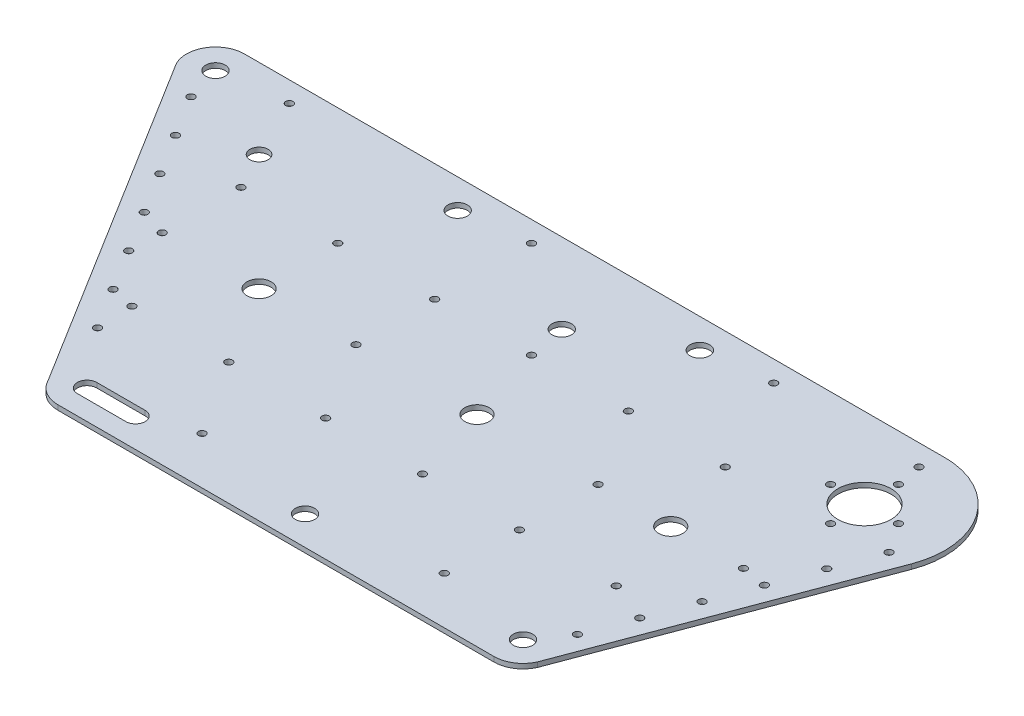
from build123d import *

# Parameters (mm, degrees)
SKETCH2_R           = 1.5
SKETCH2_R_2         = 4
SKETCH2_R_3         = 5
BOSS_EXTRUDE1_DEPTH = 2


with BuildPart() as part:
    # Sketch2 → Boss-Extrude1 (new body)
    with BuildSketch(Plane(origin=(0, 0, 0), x_dir=(1, 0, 0), z_dir=(0, 1, 0))):
        with BuildLine():
            Line((182.962816245, 145.197156615), (-106.00499968, 144.943614194))
            add(Edge.make_bspline(
                [(-106.00499968, 144.943614194), (-127.678824036, 144.924558741), (-116.08526313, 126.611232779)],
                knots=[0.000879148, 0.000879148, 0.000879148, 2.135198153, 2.135198153, 2.135198153], degree=2, weights=[1, 0.482613975, 1]))
            Line((-116.08526313, 126.611232779), (-29.699861268, -12.428586042))
            add(Edge.make_bspline(
                [(-29.699861268, -12.428586042), (-26.366669696, -18.999958873), (-18.998606102, -18.99996049)],
                knots=[5.181825727, 5.181825727, 5.181825727, 6.283185508, 6.283185508, 6.283185508], degree=2, weights=[1, 0.852168955, 1]))
            Line((-18.998606102, -18.99996049), (160.992350179, -19))
            add(Edge.make_bspline(
                [(160.992350179, -19), (168.692373591, -19.000128232), (171.90071668, -12.000000001)],
                knots=[3.141576001, 3.141576001, 3.141576001, 4.282613549, 4.282613549, 4.282613549], degree=2, weights=[1, 0.841620915, 1]))
            Line((171.90071668, -12.000000001), (214.069631291, 100.332253712))
            add(Edge.make_bspline(
                [(214.069631291, 100.332253712), (230.927799732, 145.239327045), (182.962816245, 145.197156615)],
                knots=[4.353250182, 4.353250182, 4.353250182, 6.284064455, 6.284064455, 6.284064455], degree=2, weights=[1, 0.569082143, 1]))
        make_face()
        with Locations((-38.361920415, 16.671266638)):
            Circle(SKETCH2_R, mode=Mode.SUBTRACT)
        with BuildLine():
            add(Edge.make_bspline(
                [(-18.998603467, -3), (-22.998556935, -3), (-22.998556935, -7), (-22.998556935, -11), (-18.998603467, -11)],
                knots=[3.141592654, 3.141592654, 3.141592654, 4.71238898, 4.71238898, 6.283185307, 6.283185307, 6.283185307], degree=2, weights=[1, 0.707106781, 1, 0.707106781, 1]))
            Line((-18.998603467, -3), (1.00035, -3))
            add(Edge.make_bspline(
                [(1.00035, -11), (5.00035, -11), (5.00035, -7), (5.00035, -3), (1.00035, -3)],
                knots=[3.141592654, 3.141592654, 3.141592654, 4.71238898, 4.71238898, 6.283185307, 6.283185307, 6.283185307], degree=2, weights=[1, 0.707106781, 1, 0.707106781, 1]))
            Line((1.00035, -11), (-18.998603467, -11))
        make_face(mode=Mode.SUBTRACT)
        with BuildLine():
            add(Edge.make_bspline(
                [(20.99895, 2), (18.401003692, 2), (19.699976846, -0.25), (20.99895, -2.5), (22.297923154, -0.25), (23.596896308, 2), (20.99895, 2)],
                knots=[0, 0, 0, 2.094395102, 2.094395102, 4.188790205, 4.188790205, 6.283185307, 6.283185307, 6.283185307], degree=2, weights=[1, 0.5, 1, 0.5, 1, 0.5, 1]))
        make_face(mode=Mode.SUBTRACT)
        with BuildLine():
            add(Edge.make_bspline(
                [(-38.99805, 32.999994311), (-41.595996308, 32.999994311), (-40.297023154, 30.749994311), (-38.99805, 28.499994311), (-37.699076846, 30.749994311), (-36.400103692, 32.999994311), (-38.99805, 32.999994311)],
                knots=[0, 0, 0, 2.094395102, 2.094395102, 4.188790205, 4.188790205, 6.283185307, 6.283185307, 6.283185307], degree=2, weights=[1, 0.5, 1, 0.5, 1, 0.5, 1]))
        make_face(mode=Mode.SUBTRACT)
        with Locations((-48.916261932, 33.658786529)):
            Circle(SKETCH2_R, mode=Mode.SUBTRACT)
        with Locations((-59.470762984, 50.646563195)):
            Circle(SKETCH2_R, mode=Mode.SUBTRACT)
        with BuildLine():
            add(Edge.make_bspline(
                [(0.99995, 32.999992415), (-1.597996308, 32.999992415), (-0.299023154, 30.749992415), (0.99995, 28.499992415), (2.298923154, 30.749992415), (3.597896308, 32.999992415), (0.99995, 32.999992415)],
                knots=[0, 0, 0, 2.094395102, 2.094395102, 4.188790205, 4.188790205, 6.283185307, 6.283185307, 6.283185307], degree=2, weights=[1, 0.5, 1, 0.5, 1, 0.5, 1]))
        make_face(mode=Mode.SUBTRACT)
        with BuildLine():
            add(Edge.make_bspline(
                [(40.99795, 32.999988622), (38.400003692, 32.999988622), (39.698976846, 30.749988622), (40.99795, 28.499988622), (42.296923154, 30.749988622), (43.595896308, 32.999988622), (40.99795, 32.999988622)],
                knots=[0, 0, 0, 2.094395102, 2.094395102, 4.188790205, 4.188790205, 6.283185307, 6.283185307, 6.283185307], degree=2, weights=[1, 0.5, 1, 0.5, 1, 0.5, 1]))
        make_face(mode=Mode.SUBTRACT)
        with Locations((70.99665, -7)):
            Circle(SKETCH2_R_2, mode=Mode.SUBTRACT)
        with BuildLine():
            add(Edge.make_bspline(
                [(120.99395, 2), (118.396003692, 2), (119.694976846, -0.25), (120.99395, -2.5), (122.292923154, -0.25), (123.591896308, 2), (120.99395, 2)],
                knots=[0, 0, 0, 2.094395102, 2.094395102, 4.188790205, 4.188790205, 6.283185307, 6.283185307, 6.283185307], degree=2, weights=[1, 0.5, 1, 0.5, 1, 0.5, 1]))
        make_face(mode=Mode.SUBTRACT)
        with BuildLine():
            add(Edge.make_bspline(
                [(160.99255, -3), (154.06434677, -3), (157.528448385, -9), (160.99255, -15), (164.456651615, -9), (167.92075323, -3), (160.99255, -3)],
                knots=[0, 0, 0, 2.094395102, 2.094395102, 4.188790205, 4.188790205, 6.283185307, 6.283185307, 6.283185307], degree=2, weights=[1, 0.5, 1, 0.5, 1, 0.5, 1]))
        make_face(mode=Mode.SUBTRACT)
        with Locations((170.332531489, 6.118627774)):
            Circle(SKETCH2_R, mode=Mode.SUBTRACT)
        with BuildLine():
            add(Edge.make_bspline(
                [(80.99595, 32.999985778), (78.398003692, 32.999985778), (79.696976846, 30.749985778), (80.99595, 28.499985778), (82.294923154, 30.749985778), (83.593896308, 32.999985778), (80.99595, 32.999985778)],
                knots=[0, 0, 0, 2.094395102, 2.094395102, 4.188790205, 4.188790205, 6.283185307, 6.283185307, 6.283185307], degree=2, weights=[1, 0.5, 1, 0.5, 1, 0.5, 1]))
        make_face(mode=Mode.SUBTRACT)
        with BuildLine():
            add(Edge.make_bspline(
                [(120.99395, 32.999981037), (118.396003692, 32.999981037), (119.694976846, 30.749981037), (120.99395, 28.499981037), (122.292923154, 30.749981037), (123.591896308, 32.999981037), (120.99395, 32.999981037)],
                knots=[0, 0, 0, 2.094395102, 2.094395102, 4.188790205, 4.188790205, 6.283185307, 6.283185307, 6.283185307], degree=2, weights=[1, 0.5, 1, 0.5, 1, 0.5, 1]))
        make_face(mode=Mode.SUBTRACT)
        with BuildLine():
            add(Edge.make_bspline(
                [(160.99195, 32.999978192), (158.394003692, 32.999978192), (159.692976846, 30.749978192), (160.99195, 28.499978192), (162.290923154, 30.749978192), (163.589896308, 32.999978192), (160.99195, 32.999978192)],
                knots=[0, 0, 0, 2.094395102, 2.094395102, 4.188790205, 4.188790205, 6.283185307, 6.283185307, 6.283185307], degree=2, weights=[1, 0.5, 1, 0.5, 1, 0.5, 1]))
        make_face(mode=Mode.SUBTRACT)
        with Locations((177.330672341, 24.854456596)):
            Circle(SKETCH2_R, mode=Mode.SUBTRACT)
        with Locations((184.328557385, 43.589600555)):
            Circle(SKETCH2_R, mode=Mode.SUBTRACT)
        with Locations((191.32646769, 62.324812144)):
            Circle(SKETCH2_R, mode=Mode.SUBTRACT)
        with Locations((-70.02547384, 67.634677545)):
            Circle(SKETCH2_R, mode=Mode.SUBTRACT)
        with BuildLine():
            add(Edge.make_bspline(
                [(-58.99705, 65.5), (-61.594996308, 65.5), (-60.296023154, 63.25), (-58.99705, 61), (-57.698076846, 63.25), (-56.399103692, 65.5), (-58.99705, 65.5)],
                knots=[0, 0, 0, 2.094395102, 2.094395102, 4.188790205, 4.188790205, 6.283185307, 6.283185307, 6.283185307], degree=2, weights=[1, 0.5, 1, 0.5, 1, 0.5, 1]))
        make_face(mode=Mode.SUBTRACT)
        with BuildLine():
            add(Edge.make_bspline(
                [(-91.134705429, 103.110600241), (-93.732651737, 103.110600241), (-92.433678583, 100.860600241), (-91.134705429, 98.610600241), (-89.835732276, 100.860600241), (-88.536759122, 103.110600241), (-91.134705429, 103.110600241)],
                knots=[0, 0, 0, 2.094395102, 2.094395102, 4.188790205, 4.188790205, 6.283185307, 6.283185307, 6.283185307], degree=2, weights=[1, 0.5, 1, 0.5, 1, 0.5, 1]))
        make_face(mode=Mode.SUBTRACT)
        with Locations((-80.580283096, 84.622950275)):
            Circle(SKETCH2_R, mode=Mode.SUBTRACT)
        with BuildLine():
            add(Edge.make_bspline(
                [(-58.99705, 98), (-61.594996308, 98), (-60.296023154, 95.75), (-58.99705, 93.5), (-57.698076846, 95.75), (-56.399103692, 98), (-58.99705, 98)],
                knots=[0, 0, 0, 2.094395102, 2.094395102, 4.188790205, 4.188790205, 6.283185307, 6.283185307, 6.283185307], degree=2, weights=[1, 0.5, 1, 0.5, 1, 0.5, 1]))
        make_face(mode=Mode.SUBTRACT)
        with Locations((-18.9988, 64)):
            Circle(SKETCH2_R_3, mode=Mode.SUBTRACT)
        with BuildLine():
            add(Edge.make_bspline(
                [(20.99895, 65.5), (18.401003692, 65.5), (19.699976846, 63.25), (20.99895, 61), (22.297923154, 63.25), (23.596896308, 65.5), (20.99895, 65.5)],
                knots=[0, 0, 0, 2.094395102, 2.094395102, 4.188790205, 4.188790205, 6.283185307, 6.283185307, 6.283185307], degree=2, weights=[1, 0.5, 1, 0.5, 1, 0.5, 1]))
        make_face(mode=Mode.SUBTRACT)
        with BuildLine():
            add(Edge.make_bspline(
                [(-18.99905, 98), (-21.596996308, 98), (-20.298023154, 95.75), (-18.99905, 93.5), (-17.700076846, 95.75), (-16.401103692, 98), (-18.99905, 98)],
                knots=[0, 0, 0, 2.094395102, 2.094395102, 4.188790205, 4.188790205, 6.283185307, 6.283185307, 6.283185307], degree=2, weights=[1, 0.5, 1, 0.5, 1, 0.5, 1]))
        make_face(mode=Mode.SUBTRACT)
        with BuildLine():
            add(Edge.make_bspline(
                [(20.99895, 98), (18.401003692, 98), (19.699976846, 95.75), (20.99895, 93.5), (22.297923154, 95.75), (23.596896308, 98), (20.99895, 98)],
                knots=[0, 0, 0, 2.094395102, 2.094395102, 4.188790205, 4.188790205, 6.283185307, 6.283185307, 6.283185307], degree=2, weights=[1, 0.5, 1, 0.5, 1, 0.5, 1]))
        make_face(mode=Mode.SUBTRACT)
        with BuildLine():
            add(Edge.make_bspline(
                [(-101.689209002, 120.098380963), (-104.287155309, 120.098380963), (-102.988182156, 117.848380963), (-101.689209002, 115.598380963), (-100.390235848, 117.848380963), (-99.091262694, 120.098380963), (-101.689209002, 120.098380963)],
                knots=[0, 0, 0, 2.094395102, 2.094395102, 4.188790205, 4.188790205, 6.283185307, 6.283185307, 6.283185307], degree=2, weights=[1, 0.5, 1, 0.5, 1, 0.5, 1]))
        make_face(mode=Mode.SUBTRACT)
        with BuildLine():
            add(Edge.make_bspline(
                [(-66.99665, 115.75), (-73.491515769, 115.75), (-70.244082884, 110.125), (-66.99665, 104.5), (-63.749217116, 110.125), (-60.501784231, 115.75), (-66.99665, 115.75)],
                knots=[0, 0, 0, 2.094395102, 2.094395102, 4.188790205, 4.188790205, 6.283185307, 6.283185307, 6.283185307], degree=2, weights=[1, 0.5, 1, 0.5, 1, 0.5, 1]))
        make_face(mode=Mode.SUBTRACT)
        with BuildLine():
            add(Edge.make_bspline(
                [(-109.9945, 133), (-109.9945, 126.07179677), (-103.9945, 129.535898385), (-97.9945, 133), (-103.9945, 136.464101615), (-109.9945, 139.92820323), (-109.9945, 133)],
                knots=[0, 0, 0, 2.094395102, 2.094395102, 4.188790205, 4.188790205, 6.283185307, 6.283185307, 6.283185307], degree=2, weights=[1, 0.5, 1, 0.5, 1, 0.5, 1]))
        make_face(mode=Mode.SUBTRACT)
        with Locations((-78.996040132, 136.5)):
            Circle(SKETCH2_R, mode=Mode.SUBTRACT)
        with BuildLine():
            add(Edge.make_bspline(
                [(-5.9995, 137), (-12.92770323, 137), (-9.463601615, 131), (-5.9995, 125), (-2.535398385, 131), (0.92870323, 137), (-5.9995, 137)],
                knots=[0, 0, 0, 2.094395102, 2.094395102, 4.188790205, 4.188790205, 6.283185307, 6.283185307, 6.283185307], degree=2, weights=[1, 0.5, 1, 0.5, 1, 0.5, 1]))
        make_face(mode=Mode.SUBTRACT)
        with Locations((20.99895, 136.5)):
            Circle(SKETCH2_R, mode=Mode.SUBTRACT)
        with Locations((70.99645, 64)):
            Circle(SKETCH2_R_3, mode=Mode.SUBTRACT)
        with BuildLine():
            add(Edge.make_bspline(
                [(120.99395, 65.5), (118.396003692, 65.5), (119.694976846, 63.25), (120.99395, 61), (122.292923154, 63.25), (123.591896308, 65.5), (120.99395, 65.5)],
                knots=[0, 0, 0, 2.094395102, 2.094395102, 4.188790205, 4.188790205, 6.283185307, 6.283185307, 6.283185307], degree=2, weights=[1, 0.5, 1, 0.5, 1, 0.5, 1]))
        make_face(mode=Mode.SUBTRACT)
        with BuildLine():
            add(Edge.make_bspline(
                [(60.99695, 98), (58.399003692, 98), (59.697976846, 95.75), (60.99695, 93.5), (62.295923154, 95.75), (63.594896308, 98), (60.99695, 98)],
                knots=[0, 0, 0, 2.094395102, 2.094395102, 4.188790205, 4.188790205, 6.283185307, 6.283185307, 6.283185307], degree=2, weights=[1, 0.5, 1, 0.5, 1, 0.5, 1]))
        make_face(mode=Mode.SUBTRACT)
        with BuildLine():
            add(Edge.make_bspline(
                [(100.99495, 98), (98.397003692, 98), (99.695976846, 95.75), (100.99495, 93.5), (102.293923154, 95.75), (103.592896308, 98), (100.99495, 98)],
                knots=[0, 0, 0, 2.094395102, 2.094395102, 4.188790205, 4.188790205, 6.283185307, 6.283185307, 6.283185307], degree=2, weights=[1, 0.5, 1, 0.5, 1, 0.5, 1]))
        make_face(mode=Mode.SUBTRACT)
        with BuildLine():
            add(Edge.make_bspline(
                [(140.99295, 98), (138.395003692, 98), (139.693976846, 95.75), (140.99295, 93.5), (142.291923154, 95.75), (143.590896308, 98), (140.99295, 98)],
                knots=[0, 0, 0, 2.094395102, 2.094395102, 4.188790205, 4.188790205, 6.283185307, 6.283185307, 6.283185307], degree=2, weights=[1, 0.5, 1, 0.5, 1, 0.5, 1]))
        make_face(mode=Mode.SUBTRACT)
        with Locations((150.9927, 64)):
            Circle(SKETCH2_R_3, mode=Mode.SUBTRACT)
        with BuildLine():
            add(Edge.make_bspline(
                [(180.99095, 65.5), (178.393003692, 65.5), (179.691976846, 63.25), (180.99095, 61), (182.289923154, 63.25), (183.588896308, 65.5), (180.99095, 65.5)],
                knots=[0, 0, 0, 2.094395102, 2.094395102, 4.188790205, 4.188790205, 6.283185307, 6.283185307, 6.283185307], degree=2, weights=[1, 0.5, 1, 0.5, 1, 0.5, 1]))
        make_face(mode=Mode.SUBTRACT)
        with Locations((198.324441471, 81.060193672)):
            Circle(SKETCH2_R, mode=Mode.SUBTRACT)
        with BuildLine():
            add(Edge.make_bspline(
                [(182.99085, 99.5), (180.392903692, 99.5), (181.691876846, 97.25), (182.99085, 95), (184.289823154, 97.25), (185.588796308, 99.5), (182.99085, 99.5)],
                knots=[0, 0, 0, 2.094395102, 2.094395102, 4.188790205, 4.188790205, 6.283185307, 6.283185307, 6.283185307], degree=2, weights=[1, 0.5, 1, 0.5, 1, 0.5, 1]))
        make_face(mode=Mode.SUBTRACT)
        with BuildLine():
            add(Edge.make_bspline(
                [(205.322481122, 101.295751553), (202.724534814, 101.295751553), (204.023507968, 99.045751553), (205.322481122, 96.795751553), (206.621454275, 99.045751553), (207.920427429, 101.295751553), (205.322481122, 101.295751553)],
                knots=[0, 0, 0, 2.094395102, 2.094395102, 4.188790205, 4.188790205, 6.283185307, 6.283185307, 6.283185307], degree=2, weights=[1, 0.5, 1, 0.5, 1, 0.5, 1]))
        make_face(mode=Mode.SUBTRACT)
        with BuildLine():
            add(Edge.make_bspline(
                [(53.9973, 112), (53.9973, 105.07179677), (59.9973, 108.535898385), (65.9973, 112), (59.9973, 115.464101615), (53.9973, 118.92820323), (53.9973, 112)],
                knots=[0, 0, 0, 2.094395102, 2.094395102, 4.188790205, 4.188790205, 6.283185307, 6.283185307, 6.283185307], degree=2, weights=[1, 0.5, 1, 0.5, 1, 0.5, 1]))
        make_face(mode=Mode.SUBTRACT)
        with BuildLine():
            add(Edge.make_bspline(
                [(89.995420809, 133), (89.995420809, 126.07179677), (95.995420809, 129.535898385), (101.995420809, 133), (95.995420809, 136.464101615), (89.995420809, 139.92820323), (89.995420809, 133)],
                knots=[0, 0, 0, 2.094395102, 2.094395102, 4.188790205, 4.188790205, 6.283185307, 6.283185307, 6.283185307], degree=2, weights=[1, 0.5, 1, 0.5, 1, 0.5, 1]))
        make_face(mode=Mode.SUBTRACT)
        with Locations((120.99395, 136.5)):
            Circle(SKETCH2_R, mode=Mode.SUBTRACT)
        with BuildLine():
            add(Edge.make_bspline(
                [(168.99155, 113.5), (166.393603692, 113.5), (167.692576846, 111.25), (168.99155, 109), (170.290523154, 111.25), (171.589496308, 113.5), (168.99155, 113.5)],
                knots=[0, 0, 0, 2.094395102, 2.094395102, 4.188790205, 4.188790205, 6.283185307, 6.283185307, 6.283185307], degree=2, weights=[1, 0.5, 1, 0.5, 1, 0.5, 1]))
        make_face(mode=Mode.SUBTRACT)
        with BuildLine():
            ThreePointArc((182.992000002, 122.999999999), (190.770174595, 119.778174592), (193.992000002, 111.999999999))
            ThreePointArc((193.992000002, 111.999999999), (175.213825408, 104.221825406), (182.992000002, 122.999999999))
        make_face(mode=Mode.SUBTRACT)
        with BuildLine():
            add(Edge.make_bspline(
                [(196.99015, 113.5), (194.392203692, 113.5), (195.691176846, 111.25), (196.99015, 109), (198.289123154, 111.25), (199.588096308, 113.5), (196.99015, 113.5)],
                knots=[0, 0, 0, 2.094395102, 2.094395102, 4.188790205, 4.188790205, 6.283185307, 6.283185307, 6.283185307], degree=2, weights=[1, 0.5, 1, 0.5, 1, 0.5, 1]))
        make_face(mode=Mode.SUBTRACT)
        with BuildLine():
            add(Edge.make_bspline(
                [(182.99085, 127.5), (180.392903692, 127.5), (181.691876846, 125.25), (182.99085, 123), (184.289823154, 125.25), (185.588796308, 127.5), (182.99085, 127.5)],
                knots=[0, 0, 0, 2.094395102, 2.094395102, 4.188790205, 4.188790205, 6.283185307, 6.283185307, 6.283185307], degree=2, weights=[1, 0.5, 1, 0.5, 1, 0.5, 1]))
        make_face(mode=Mode.SUBTRACT)
        with Locations((180.99095, 136.5)):
            Circle(SKETCH2_R, mode=Mode.SUBTRACT)
    extrude(amount=BOSS_EXTRUDE1_DEPTH)


solid = part.part
